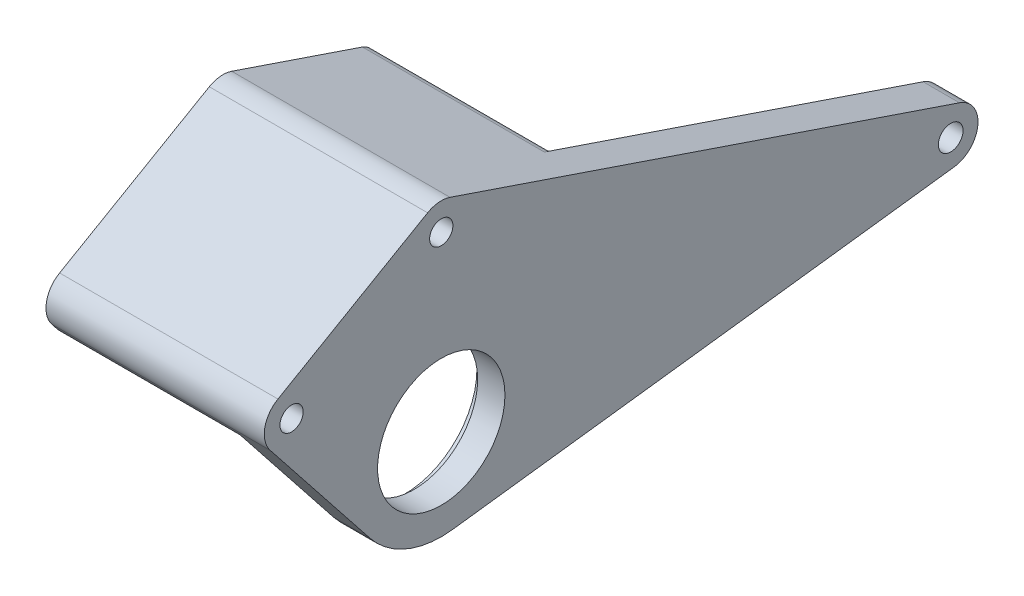
from build123d import *

# Parameters (mm, degrees)
SKETCH1_R           = 2.159
SKETCH1_R_2         = 11.112499999999992
SKETCH1_R_3         = 2.032000000000007
BOSS_EXTRUDE1_DEPTH = 6.35
SKETCH2_R           = 12.573000000000004
CUT_EXTRUDE1_DEPTH  = 1.5875
BOSS_EXTRUDE2_DEPTH = 31.75
FILLET1_R           = 3.175


with BuildPart() as part:
    # Sketch1 → Boss-Extrude1 (new body)
    with BuildSketch(Plane(origin=(0, 0, 0), x_dir=(0, 0, -1), z_dir=(1, 0, 0))):
        with BuildLine():
            Line((1.5301738418707327, 4.509986060250583), (-87.36982615812926, 34.67248606025057))
            ThreePointArc((-87.36982615812926, 34.67248606025057), (-89.36716479323593, 34.90203197119301), (-91.28125, 34.28694598552338))
            Line((-91.28125, 34.28694598552338), (-117.40274124164804, 19.205695985523512))
            ThreePointArc((-117.40274124164804, 19.205695985523512), (-119.69949191381465, 15.97439946185337), (-118.75477455872962, 12.124224142081347))
            Line((-118.75477455872962, 12.124224142081347), (-101.34427772360533, -9.856752859729228))
            ThreePointArc((-101.34427772360533, -9.856752859729228), (-94.90303427686699, -14.696230961398246), (-86.91562499999999, -15.750488273681404))
            Line((-86.91562499999999, -15.750488273681404), (0.5953125000000009, -4.725146482104418))
            ThreePointArc((0.5953125000000009, -4.725146482104418), (4.738284638567616, -0.47965084583910245), (1.5301738418707327, 4.509986060250583))
        make_face()
        Circle(SKETCH1_R, mode=Mode.SUBTRACT)
        with Locations((-88.89999999999999, -1.11e-14)):
            Circle(SKETCH1_R_2, mode=Mode.SUBTRACT)
        with Locations((-88.89999999999999, 30.162499999999987)):
            Circle(SKETCH1_R_3, mode=Mode.SUBTRACT)
        with Locations((-115.02149124164804, 15.081250000000109)):
            Circle(SKETCH1_R_3, mode=Mode.SUBTRACT)
    extrude(amount=BOSS_EXTRUDE1_DEPTH)

    # Sketch2 → Cut-Extrude1 (cut)
    with BuildSketch(Plane(origin=(6.35, 0, 0), x_dir=(0, 0, -1), z_dir=(1, 0, 0))):
        with Locations((-88.89999999999999, -1.11e-14)):
            Circle(SKETCH2_R)
    extrude(amount=-CUT_EXTRUDE1_DEPTH, mode=Mode.SUBTRACT)

    # Sketch3 → Boss-Extrude2 (add)
    with BuildSketch(Plane(origin=(6.35, 0, 0), x_dir=(0, 0, -1), z_dir=(1, 0, 0))):
        with BuildLine():
            Line((-91.28125, 34.28694598552338), (-117.40274124164804, 19.205695985523512))
            ThreePointArc((-117.40274124164804, 19.205695985523512), (-119.69949191381465, 15.97439946185337), (-118.75477455872964, 12.124224142081342))
            Line((-118.75477455872964, 12.124224142081342), (-114.28067912721544, 6.4756209048884985))
            ThreePointArc((-114.28067912721544, 6.4756209048884985), (-95.60272826068322, 25.321650280460346), (-70.04692626419055, 18.184448019520193))
            Line((-70.04692626419055, 18.184448019520193), (-57.30325242312538, 24.47132711444569))
            Line((-57.30325242312538, 24.47132711444569), (-87.36982615812926, 34.67248606025057))
            ThreePointArc((-87.36982615812926, 34.67248606025057), (-89.36716479323593, 34.90203197119301), (-91.28125, 34.28694598552338))
        make_face()
        Polygon((-88.89999999999998, 33.90199769354121), (-92.13850000000001, 32.03224884677059), (-92.13850000000001, 28.29275115322938), (-88.9, 26.423002306458773), (-85.6615, 28.292751153229382), (-85.6615, 32.03224884677062), align=None, mode=Mode.SUBTRACT)
        Polygon((-115.02149124164805, 18.820747693541296), (-118.25999124164802, 16.950998846770705), (-118.25999124164802, 13.211501153229497), (-115.02149124164802, 11.341752306458893), (-111.78299124164803, 13.211501153229495), (-111.78299124164803, 16.950998846770684), align=None, mode=Mode.SUBTRACT)
    extrude(amount=BOSS_EXTRUDE2_DEPTH)

    # Fillet1
    fillet1_edges = [part.edges().sort_by_distance(p)[0] for p in [
        (22.225, 24.47132711444569, 57.30325242312538),
        (22.225, 18.184448019520193, 70.04692626419055),
        (22.225, 6.475620904888499, 114.28067912721545),
    ]]
    fillet(fillet1_edges, radius=FILLET1_R)


with BuildPart() as body_2:
    # Mirror1: mirrored copy
    add(part.part.mirror(Plane(origin=(6.35, 0, 0), x_dir=(0, 0, 1), z_dir=(1, 0, 0))))


solid = body_2.part
